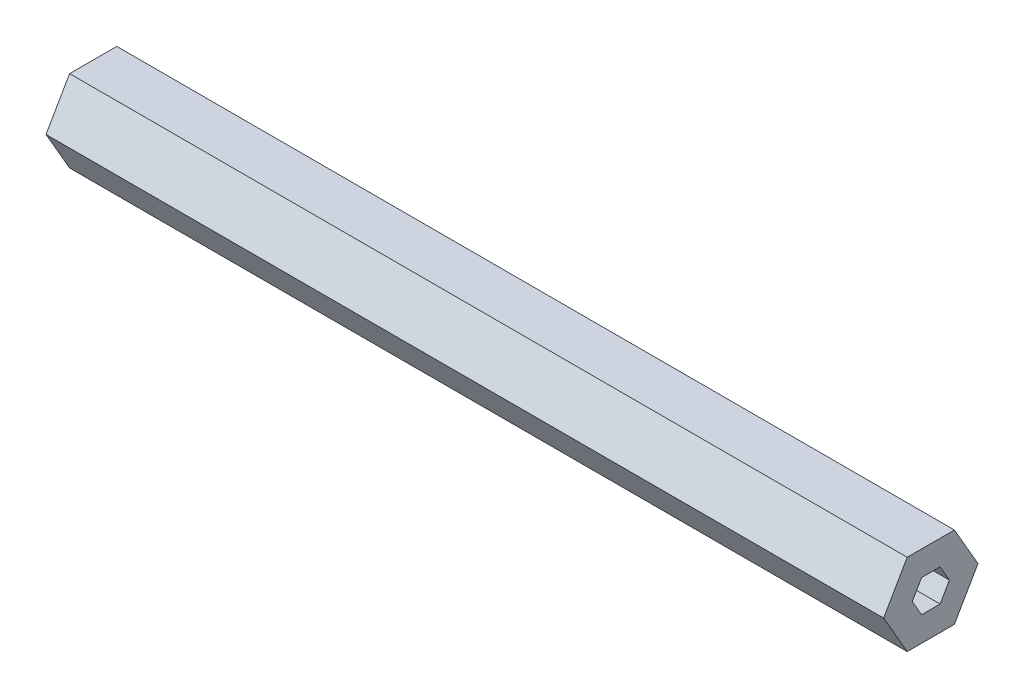
from build123d import *

# Parameters (mm, degrees)
BOSS_EXTRUDE1_DEPTH = 130.175


with BuildPart() as part:
    # Sketch1 → Boss-Extrude1 (new body)
    with BuildSketch(Plane(origin=(0, 0, 0), x_dir=(0, 0, -1), z_dir=(1, 0, 0))):
        Polygon((7.332348419, 0), (3.666174209, 6.35), (-3.666174209, 6.35), (-7.332348419, 0), (-3.666174209, -6.35), (3.666174209, -6.35), align=None)
        Polygon((2.886751346, 0), (1.443375673, 2.5), (-1.443375673, 2.5), (-2.886751346, 0), (-1.443375673, -2.5), (1.443375673, -2.5), align=None, mode=Mode.SUBTRACT)
    extrude(amount=BOSS_EXTRUDE1_DEPTH)


solid = part.part
